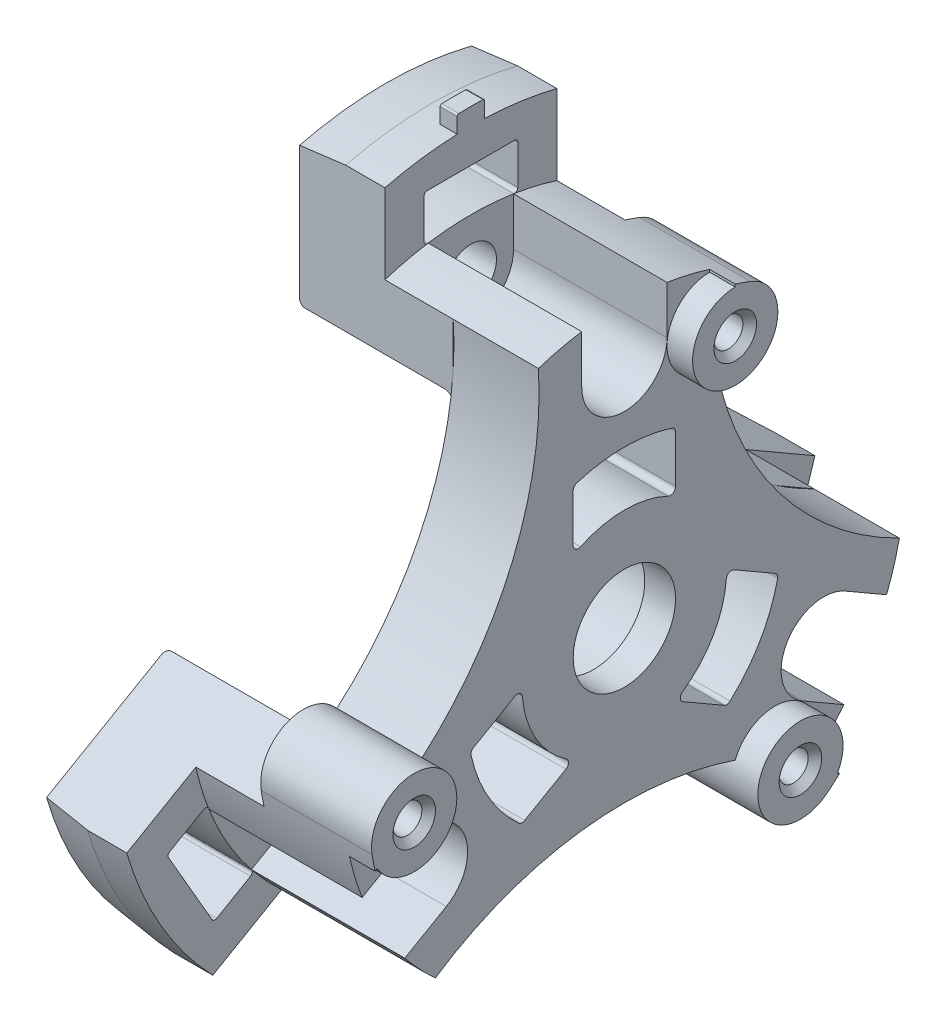
from build123d import *
from build123d.topology import SkipClean

# Parameters (mm, degrees)
SKETCH_2_R                           = 20
CUT_EXTRUDE_1_DEPTH                  = 10
PATTERN_CIRCULAR_1_COUNT             = 3
CUT_EXTRUDE_START                    = -10
CUT_EXTRUDE_2_DEPTH                  = 10
PATTERN_CIRCULAR_2_COUNT             = 3
SKETCH_4_R                           = 1.5
EXTRUDE_1_DEPTH                      = 9
PATTERN_CIRCULAR_3_COUNT             = 3
CUT_EXTRUDE_START_2                  = -1.7
CUT_EXTRUDE_3_DEPTH                  = 1.7
PATTERN_CIRCULAR_4_COUNT             = 3
CUT_EXTRUDE_4_DEPTH                  = 9
PATTERN_CIRCULAR_5_COUNT             = 3
EXTRUDE_START                        = -6.5
EXTRUDE_2_DEPTH                      = 6.5
SKETCH_9_R                           = 0.85
CUT_EXTRUDE_7_DEPTH                  = 6.4
CHAMFER_3_SIZE                       = 0.4
PATTERN_CIRCULAR_8_COUNT             = 3
CHAMFER_3_OF_PATTERN_CIRCULAR_8_SIZE = 0.4
CHAMFER_4_SIZE                       = 0.5
CHAMFER_4_SIZE2                      = 0.866025404
FILLET_6_R                           = 0.5
FILLET_7_R                           = 0.5
EXTRUDE_START_2                      = -5
EXTRUDE_3_DEPTH                      = 5
PATTERN_CIRCULAR_9_COUNT             = 3
EXTRUDE_4_DEPTH                      = 1
FILLET_9_R                           = 0.3
FILLET_10_R                          = 0.2


with BuildPart() as part:
    # 草图1 → 旋转1 (revolve)
    with BuildSketch(Plane.XY, mode=Mode.PRIVATE) as revolve_1_sk:
        Polygon((-7, 6), (-5, 6), (-5, 16.5), (0, 16.5), (0, 3), (-1.8, 3), (-1.8, 3.975), (-7, 3.975), align=None)
    revolve(revolve_1_sk.sketch.rotate(Axis((-65.742857143, 0, 0), (1, 0, 0)), 90), axis=Axis((-65.742857143, 0, 0), (1, 0, 0)))

    # 草图2 → 切除-拉伸1 (cut)
    with BuildSketch(Plane.ZY.offset(5)):
        with Locations((-25, 14.43375673)):
            Circle(SKETCH_2_R)
    cut_extrude_1 = extrude(amount=-CUT_EXTRUDE_1_DEPTH, mode=Mode.SUBTRACT)

    # 阵列(圆周)1: 切除-拉伸1 ×3 about axis
    pattern_circular_1_axis = Axis((0, 0, 0), (1, 0, 0))
    for i in range(1, PATTERN_CIRCULAR_1_COUNT):
        add(cut_extrude_1.rotate(pattern_circular_1_axis, i * 360 / PATTERN_CIRCULAR_1_COUNT), mode=Mode.SUBTRACT)

    # 草图3 → 切除-拉伸2 (cut)
    with BuildSketch(Plane.ZY.offset(5).offset(CUT_EXTRUDE_START)):
        with BuildLine():
            Line((-3, 8.480566019), (-3, 5.692099788))
            ThreePointArc((-3, 5.692099788), (-2.860356745, 5.438553512), (-2.571428571, 5.421047417))
            ThreePointArc((-2.571428571, 5.421047417), (0, 6), (2.571428571, 5.421047417))
            ThreePointArc((2.571428571, 5.421047417), (2.860356745, 5.438553512), (3, 5.692099788))
            Line((3, 5.692099788), (3, 8.480566019))
            ThreePointArc((3, 8.480566019), (2.9421811, 8.657620571), (2.791011236, 8.766427795))
            ThreePointArc((2.791011236, 8.766427795), (0, 9.2), (-2.791011236, 8.766427795))
            ThreePointArc((-2.791011236, 8.766427795), (-2.9421811, 8.657620571), (-3, 8.480566019))
        make_face()
    cut_extrude_2 = extrude(amount=CUT_EXTRUDE_2_DEPTH, mode=Mode.SUBTRACT)

    # 阵列(圆周)2: 切除-拉伸2 ×3 about axis
    pattern_circular_2_axis = Axis((0, 0, 0), (1, 0, 0))
    for i in range(1, PATTERN_CIRCULAR_2_COUNT):
        add(cut_extrude_2.rotate(pattern_circular_2_axis, i * 360 / PATTERN_CIRCULAR_2_COUNT), mode=Mode.SUBTRACT)

    # 草图4 → 凸台-拉伸1 (add)
    with BuildSketch(Plane.ZY.offset(5)):
        with BuildLine():
            Line((-5.040834524, 15.711142139), (-5.040834524, 11.928641469))
            ThreePointArc((-5.040834524, 11.928641469), (-3.875431802, 12.356517647), (-2.674412578, 12.670833333))
            ThreePointArc((-2.674412578, 12.670833333), (0, 10.7), (2.674412578, 12.670833333))
            ThreePointArc((2.674412578, 12.670833333), (3.875431802, 12.356517647), (5.040834524, 11.928641469))
            Line((5.040834524, 11.928641469), (5.040834524, 15.711142139))
            ThreePointArc((5.040834524, 15.711142139), (0, 16.5), (-5.040834524, 15.711142139))
        make_face()
        with Locations((0, 13.5)):
            Circle(SKETCH_4_R, mode=Mode.SUBTRACT)
    extrude_1 = extrude(amount=EXTRUDE_1_DEPTH)

    # 阵列(圆周)3: 凸台-拉伸1 ×3 about axis
    pattern_circular_3_axis = Axis((0, 0, 0), (1, 0, 0))
    for i in range(1, PATTERN_CIRCULAR_3_COUNT):
        add(extrude_1.rotate(pattern_circular_3_axis, i * 360 / PATTERN_CIRCULAR_3_COUNT))

    # 草图5 → 切除-拉伸3 (cut)
    with BuildSketch(Plane.ZY.offset(14).offset(CUT_EXTRUDE_START_2)):
        with BuildLine():
            Line((-2.8, 12.643674308), (-2.8, 9.290818443))
            Line((-2.8, 9.290818443), (2.8, 9.290818443))
            Line((2.8, 9.290818443), (2.8, 12.643674308))
            ThreePointArc((2.8, 12.643674308), (0, 12.95), (-2.8, 12.643674308))
        make_face()
    cut_extrude_3 = extrude(amount=CUT_EXTRUDE_3_DEPTH, mode=Mode.SUBTRACT)

    # 阵列(圆周)4: 切除-拉伸3 ×3 about axis
    pattern_circular_4_axis = Axis((-65.742857143, 0, 0), (-1, 0, 0))
    for i in range(1, PATTERN_CIRCULAR_4_COUNT):
        add(cut_extrude_3.rotate(pattern_circular_4_axis, i * 360 / PATTERN_CIRCULAR_4_COUNT), mode=Mode.SUBTRACT)

    # 草图6 → 切除-拉伸4 (cut)
    with BuildSketch(Plane(origin=(0, 0, 0), x_dir=(0, 0, -1), z_dir=(1, 0, 0))):
        with BuildLine():
            Line((-2.5, 16.30950643), (-2.5, 13.5))
            ThreePointArc((-2.5, 13.5), (0, 11), (2.5, 13.5))
            Line((2.5, 13.5), (2.5, 16.30950643))
            ThreePointArc((2.5, 16.30950643), (0, 16.5), (-2.5, 16.30950643))
        make_face()
    cut_extrude_4 = extrude(amount=-CUT_EXTRUDE_4_DEPTH, mode=Mode.SUBTRACT)

    # 阵列(圆周)5: 切除-拉伸4 ×3 about axis
    pattern_circular_5_axis = Axis((0, 0, 0), (1, 0, 0))
    for i in range(1, PATTERN_CIRCULAR_5_COUNT):
        add(cut_extrude_4.rotate(pattern_circular_5_axis, i * 360 / PATTERN_CIRCULAR_5_COUNT), mode=Mode.SUBTRACT)

    # 草图7 → 凸台-拉伸2 (add)
    with BuildSketch(Plane.ZY.offset(5).offset(EXTRUDE_START)):
        with BuildLine():
            Line((-5, 15.576696831), (-5, 15.724185194))
            ThreePointArc((-5, 15.724185194), (-5.448667451, 15.574402814), (-5.892857143, 15.411821265))
            ThreePointArc((-5.892857143, 15.411821265), (-4.546023726, 10.618261242), (-5, 15.576696831))
        make_face()
    extrude_2 = extrude(amount=EXTRUDE_2_DEPTH)

    # 草图9 → 切除-拉伸7 (cut)
    with SkipClean():  # the faces are left unmerged after this step: merging them gives an invalid solid
        with BuildSketch(Plane(origin=(1.5, 0, 0), x_dir=(0, 0, -1), z_dir=(1, 0, 0))):
            with Locations((5, 13.076696831)):
                Circle(SKETCH_9_R)
        cut_extrude_7 = extrude(amount=-CUT_EXTRUDE_7_DEPTH, mode=Mode.SUBTRACT)

    # 倒角3
    chamfer_3_edges = [part.edges().sort_by_distance(p)[0] for p in [
        (1.5, 13.076696831, -4.15),
    ]]
    chamfer(chamfer_3_edges, length=CHAMFER_3_SIZE)

    # 阵列(圆周)8: 凸台-拉伸2, 切除-拉伸7 ×3 about axis
    with SkipClean():  # the faces are left unmerged after this step: merging them gives an invalid solid
        pattern_circular_8_axis = Axis((0, 0, 0), (1, 0, 0))
        add([extrude_2.rotate(pattern_circular_8_axis, i * 360 / PATTERN_CIRCULAR_8_COUNT) for i in range(1, PATTERN_CIRCULAR_8_COUNT)])
        add([cut_extrude_7.rotate(pattern_circular_8_axis, i * 360 / PATTERN_CIRCULAR_8_COUNT) for i in range(1, PATTERN_CIRCULAR_8_COUNT)], mode=Mode.SUBTRACT)

    # 倒角3 of 阵列(圆周)8
    chamfer_3_of_pattern_circular_8_edges = [part.edges().sort_by_distance(p)[0] for p in [
        (1.5, -2.94434299, 13.399751653),
        (1.5, -10.132353841, -9.249751653),
    ]]
    chamfer(chamfer_3_of_pattern_circular_8_edges, length=CHAMFER_3_OF_PATTERN_CIRCULAR_8_SIZE)

    # 倒角4
    chamfer_4_edges = [part.edges().sort_by_distance(p)[0] for p in [
        (-7, 0, -3.975),
    ]]
    chamfer_4_side = [part.faces().sort_by_distance(p)[0] for p in [
        (-7, 0, -4.144705627),
    ]]
    chamfer(chamfer_4_edges, length=CHAMFER_4_SIZE, length2=CHAMFER_4_SIZE2, reference=chamfer_4_side[0])

    # 圆角6
    # the kernel refuses this fillet: 0.5 mm, written as the material it adds along each edge
    with BuildSketch(Plane(origin=(-5, 0, 0), x_dir=(0, 0.8793281137807236, -0.47621640911967206), z_dir=(0, -0.47621640911967206, -0.8793281137807236))) as fillet_6_piece_1_section:
        with BuildLine():
            CenterArc((12.95 - FILLET_6_R, -FILLET_6_R), FILLET_6_R, 0, 90)
            Line((12.95, -FILLET_6_R), (12.95, 0))
            Line((12.95, 0), (12.95 - FILLET_6_R, 0))
        make_face()
    fillet_6_piece_1 = revolve(axis=Axis((-5, 0, 0), (1, 0, 0)), revolution_arc=22.050697628, mode=Mode.PRIVATE)
    fillet_6_piece_1 = split(fillet_6_piece_1, bisect_by=Plane(origin=(-5.112168205, 12.222030321, -5.040834524), z_dir=(0, 0, 1)), keep=Keep.TOP, mode=Mode.PRIVATE)
    fillet_6_piece_1 = fillet_6_piece_1 - Plane(origin=(-5.112168205, 13.5, 0), x_dir=(0, -0.2961309523809526, -0.9551473493874911), z_dir=(1, 0, 0)) * Cylinder(2.8, 52, mode=Mode.PRIVATE)
    add(fillet_6_piece_1)
    with BuildSketch(Plane(origin=(-5, 13.5, 0), x_dir=(0, 0.1457375577042098, 0.9893232860265708), z_dir=(0, 0.9893232860265708, -0.1457375577042098))) as fillet_6_piece_2:
        with BuildLine():
            CenterArc((2.8 + FILLET_6_R, -FILLET_6_R), FILLET_6_R, 90, 90)
            Line((2.8, -FILLET_6_R), (2.8, 0))
            Line((2.8, 0), (2.8 + FILLET_6_R, 0))
        make_face()
    revolve(axis=Axis((-5, 13.5, 0), (1, 0, 0)), revolution_arc=196.759983694)
    with BuildSketch(Plane(origin=(-5, 0, 0), x_dir=(0, 0.9937914719955359, 0.11125875331382269), z_dir=(0, 0.11125875331382269, -0.9937914719955359))) as fillet_6_piece_3_section:
        with BuildLine():
            CenterArc((12.95 - FILLET_6_R, -FILLET_6_R), FILLET_6_R, 0, 90)
            Line((12.95, -FILLET_6_R), (12.95, 0))
            Line((12.95, 0), (12.95 - FILLET_6_R, 0))
        make_face()
    fillet_6_piece_3 = revolve(axis=Axis((-5, 0, 0), (1, 0, 0)), revolution_arc=22.050697628, mode=Mode.PRIVATE)
    fillet_6_piece_3 = split(fillet_6_piece_3, bisect_by=Plane(origin=(-5.11216821, 12.222030475, 5.040834524), z_dir=(0, 0, -1)), keep=Keep.TOP, mode=Mode.PRIVATE)
    fillet_6_piece_3 = fillet_6_piece_3 - Plane(origin=(-5.11216821, 13.5, 0), x_dir=(0, -0.2961309523809526, -0.9551473493874911), z_dir=(1, 0, 0)) * Cylinder(2.8, 52, mode=Mode.PRIVATE)
    add(fillet_6_piece_3)
    with BuildSketch(Plane(origin=(-5, 0, 0), x_dir=(0, -0.8520795648870015, -0.5234122802361234), z_dir=(0, -0.5234122802361234, 0.8520795648870015))) as fillet_6_piece_4_section:
        with BuildLine():
            CenterArc((12.95 - FILLET_6_R, -FILLET_6_R), FILLET_6_R, 0, 90)
            Line((12.95, -FILLET_6_R), (12.95, 0))
            Line((12.95, 0), (12.95 - FILLET_6_R, 0))
        make_face()
    fillet_6_piece_4 = revolve(axis=Axis((-5, 0, 0), (1, 0, 0)), revolution_arc=22.050697628, mode=Mode.PRIVATE)
    fillet_6_piece_4 = split(fillet_6_piece_4, bisect_by=Plane(origin=(-5.112168205, -10.476505914, -8.064171482), z_dir=(0, 0.8660254037844384, -0.5000000000000004)), keep=Keep.TOP, mode=Mode.PRIVATE)
    fillet_6_piece_4 = fillet_6_piece_4 - Plane(origin=(-5.112168205, -6.75, -11.691342951), x_dir=(0, -0.6791163927364616, 0.7340306023025307), z_dir=(1, 0, 0)) * Cylinder(2.8, 52, mode=Mode.PRIVATE)
    add(fillet_6_piece_4)
    with BuildSketch(Plane(origin=(-5, -6.75, -11.691342951), x_dir=(0, 0.7839103194024034, -0.6208740702706321), z_dir=(0, -0.6208740702706321, -0.7839103194024034))) as fillet_6_piece_5:
        with BuildLine():
            CenterArc((2.8 + FILLET_6_R, -FILLET_6_R), FILLET_6_R, 90, 90)
            Line((2.8, -FILLET_6_R), (2.8, 0))
            Line((2.8, 0), (2.8 + FILLET_6_R, 0))
        make_face()
    revolve(axis=Axis((-5, -6.75, -11.691342951), (1, 0, 0)), revolution_arc=196.759983694)
    with BuildSketch(Plane(origin=(-5, 0, 0), x_dir=(0, -0.4005428292346119, -0.9162780374693769), z_dir=(0, -0.9162780374693769, 0.4005428292346119))) as fillet_6_piece_6_section:
        with BuildLine():
            CenterArc((12.95 - FILLET_6_R, -FILLET_6_R), FILLET_6_R, 0, 90)
            Line((12.95, -FILLET_6_R), (12.95, 0))
            Line((12.95, 0), (12.95 - FILLET_6_R, 0))
        make_face()
    fillet_6_piece_6 = revolve(axis=Axis((-5, 0, 0), (1, 0, 0)), revolution_arc=22.050697628, mode=Mode.PRIVATE)
    fillet_6_piece_6 = split(fillet_6_piece_6, bisect_by=Plane(origin=(-5.11216821, -1.745524484, -13.105006139), z_dir=(0, -0.8660254037844384, 0.5000000000000004)), keep=Keep.TOP, mode=Mode.PRIVATE)
    fillet_6_piece_6 = fillet_6_piece_6 - Plane(origin=(-5.11216821, -6.75, -11.691342951), x_dir=(0, -0.6791163927364616, 0.7340306023025307), z_dir=(1, 0, 0)) * Cylinder(2.8, 52, mode=Mode.PRIVATE)
    add(fillet_6_piece_6)
    with BuildSketch(Plane(origin=(-5, 0, 0), x_dir=(0, -0.027248548893721882, 0.999628689355796), z_dir=(0, 0.999628689355796, 0.027248548893721882))) as fillet_6_piece_7_section:
        with BuildLine():
            CenterArc((12.95 - FILLET_6_R, -FILLET_6_R), FILLET_6_R, 0, 90)
            Line((12.95, -FILLET_6_R), (12.95, 0))
            Line((12.95, 0), (12.95 - FILLET_6_R, 0))
        make_face()
    fillet_6_piece_7 = revolve(axis=Axis((-5, 0, 0), (1, 0, 0)), revolution_arc=22.050697628, mode=Mode.PRIVATE)
    fillet_6_piece_7 = split(fillet_6_piece_7, bisect_by=Plane(origin=(-5.112168205, -1.745524407, 13.105006005), z_dir=(0, -0.8660254037844388, -0.49999999999999983)), keep=Keep.TOP, mode=Mode.PRIVATE)
    fillet_6_piece_7 = fillet_6_piece_7 - Plane(origin=(-5.112168205, -6.75, 11.691342951), x_dir=(0, 0.9752473451174146, 0.22111674708496049), z_dir=(1, 0, 0)) * Cylinder(2.8, 52, mode=Mode.PRIVATE)
    add(fillet_6_piece_7)
    with BuildSketch(Plane(origin=(-5, -6.75, 11.691342951), x_dir=(0, -0.9296478771066136, -0.36844921575593936), z_dir=(0, -0.36844921575593936, 0.9296478771066136))) as fillet_6_piece_8:
        with BuildLine():
            CenterArc((2.8 + FILLET_6_R, -FILLET_6_R), FILLET_6_R, 90, 90)
            Line((2.8, -FILLET_6_R), (2.8, 0))
            Line((2.8, 0), (2.8 + FILLET_6_R, 0))
        make_face()
    revolve(axis=Axis((-5, -6.75, 11.691342951), (1, 0, 0)), revolution_arc=196.759983694)
    with BuildSketch(Plane(origin=(-5, 0, 0), x_dir=(0, -0.5932486427609238, 0.8050192841555547), z_dir=(0, 0.8050192841555547, 0.5932486427609238))) as fillet_6_piece_9_section:
        with BuildLine():
            CenterArc((12.95 - FILLET_6_R, -FILLET_6_R), FILLET_6_R, 0, 90)
            Line((12.95, -FILLET_6_R), (12.95, 0))
            Line((12.95, 0), (12.95 - FILLET_6_R, 0))
        make_face()
    fillet_6_piece_9 = revolve(axis=Axis((-5, 0, 0), (1, 0, 0)), revolution_arc=22.050697628, mode=Mode.PRIVATE)
    fillet_6_piece_9 = split(fillet_6_piece_9, bisect_by=Plane(origin=(-5.11216821, -10.476505991, 8.064171615), z_dir=(0, 0.8660254037844388, 0.49999999999999983)), keep=Keep.TOP, mode=Mode.PRIVATE)
    fillet_6_piece_9 = fillet_6_piece_9 - Plane(origin=(-5.11216821, -6.75, 11.691342951), x_dir=(0, 0.9752473451174146, 0.22111674708496049), z_dir=(1, 0, 0)) * Cylinder(2.8, 52, mode=Mode.PRIVATE)
    add(fillet_6_piece_9)

    # 圆角7
    fillet_7_edges = [part.edges().sort_by_distance(p)[0] for p in [
        (-7, 0, -6),
    ]]
    fillet(fillet_7_edges, radius=FILLET_7_R)

    # 草图11 → 凸台-拉伸3 (add)
    with BuildSketch(Plane.ZY.offset(14).offset(EXTRUDE_START_2)):
        with BuildLine():
            Line((-5.040834524, 15.711142139), (-5.040834524, 20.386024313))
            ThreePointArc((-5.040834524, 20.386024313), (-2.539044054, 20.845940979), (0, 21))
            ThreePointArc((0, 21), (2.539044054, 20.845940979), (5.040834524, 20.386024313))
            Line((5.040834524, 20.386024313), (5.040834524, 15.711142139))
            ThreePointArc((5.040834524, 15.711142139), (3.905398597, 16.031152853), (2.75, 16.269219404))
            Line((2.75, 16.269219404), (2.75, 18.8))
            ThreePointArc((2.75, 18.8), (2.691421356, 18.941421356), (2.55, 19))
            Line((2.55, 19), (-2.55, 19))
            ThreePointArc((-2.55, 19), (-2.691421356, 18.941421356), (-2.75, 18.8))
            Line((-2.75, 18.8), (-2.75, 16.269219404))
            ThreePointArc((-2.75, 16.269219404), (-3.905398597, 16.031152853), (-5.040834524, 15.711142139))
        make_face()
    extrude_3 = extrude(amount=EXTRUDE_3_DEPTH)

    # 阵列(圆周)9: 凸台-拉伸3 ×3 about axis
    pattern_circular_9_axis = Axis((0, 0, 0), (1, 0, 0))
    for i in range(1, PATTERN_CIRCULAR_9_COUNT):
        add(extrude_3.rotate(pattern_circular_9_axis, i * 360 / PATTERN_CIRCULAR_9_COUNT))

    # 草图12 → 凸台-拉伸4 (add)
    with BuildSketch(Plane(origin=(-9, 0, 0), x_dir=(0, 0, -1), z_dir=(1, 0, 0))):
        with BuildLine():
            Line((-0.8, 21.888809927), (-0.8, 20.984756372))
            ThreePointArc((-0.8, 20.984756372), (0, 21), (0.8, 20.984756372))
            Line((0.8, 20.984756372), (0.8, 21.888809927))
            ThreePointArc((0.8, 21.888809927), (0.771831869, 21.958381348), (0.703196347, 21.98875883))
            ThreePointArc((0.703196347, 21.98875883), (0, 22), (-0.703196347, 21.98875883))
            ThreePointArc((-0.703196347, 21.98875883), (-0.771831869, 21.958381348), (-0.8, 21.888809927))
        make_face()
    extrude(amount=-EXTRUDE_4_DEPTH)

    # 圆角9
    fillet_9_edges = [part.edges().sort_by_distance(p)[0] for p in [
        (-14, 12.538695277, -3.237841991),
        (-14, 12.538695277, 3.237841991),
        (-14, -9.073401056, -9.239907645),
        (-14, -3.465294221, -12.477749635),
        (-14, -3.465294221, 12.477749635),
        (-14, -9.073401056, 9.239907645),
    ]]
    fillet(fillet_9_edges, radius=FILLET_9_R)

    # 圆角10
    fillet_10_edges = [part.edges().sort_by_distance(p)[0] for p in [
        (-11.5, 16.269219404, -2.75),
        (-11.5, 16.269219404, 2.75),
        (-11.5, -10.516179562, -12.714557303),
        (-11.5, -5.753039841, -15.464557303),
        (-11.5, -5.753039841, 15.464557303),
        (-11.5, -10.516179562, 12.714557303),
    ]]
    fillet(fillet_10_edges, radius=FILLET_10_R)

    # 草图15 → 切除-旋转2 (revolve, cut)
    with BuildSketch(Plane.XY, mode=Mode.PRIVATE) as cut_revolve_2_sk:
        Polygon((-16.107755243, 21), (-11.3, 21), (-16.107755243, 20.409681884), align=None)
    revolve(cut_revolve_2_sk.sketch.rotate(Axis((8.388965583, 0, 0), (-1, 0, 0)), 90), axis=Axis((8.388965583, 0, 0), (-1, 0, 0)), mode=Mode.SUBTRACT)


solid = part.part
